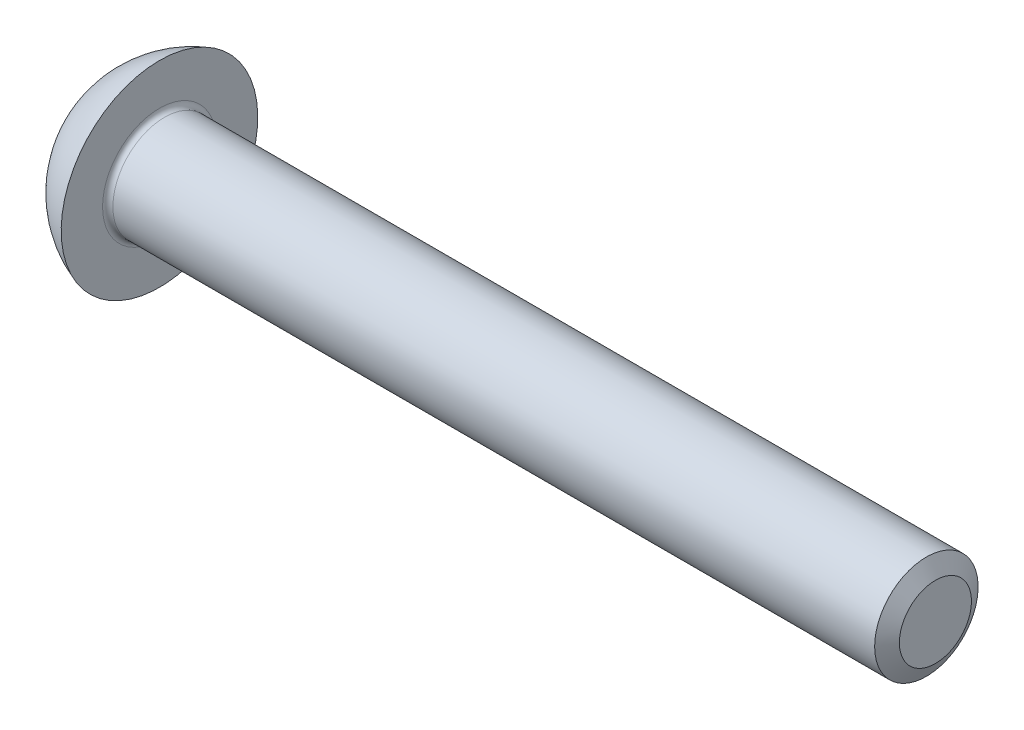
from build123d import *

# Parameters (mm, degrees)
CUT_EXTRUDE_1_DEPTH = 2.2


with BuildPart() as part:
    # 草图1 → 旋转1 (revolve)
    with BuildSketch(Plane.XY):
        with BuildLine():
            Line((0, 2), (-29.8, 2))
            ThreePointArc((-29.8, 2), (-29.941421356, 2.058578644), (-30, 2.2))
            Line((-30, 2.2), (-30, 3.8))
            ThreePointArc((-30, 3.8), (-31.264955669, 3.101612484), (-32.2, 2))
            Line((-32.2, 2), (-32.2, 0))
            Line((-32.2, 0), (0, 0))
            Line((0, 0), (0, 2))
        make_face()
    revolve(axis=Axis((-32.2, 0, 0), (1, 0, 0)))

    # 草图2 → 切除-拉伸1 (cut)
    with BuildSketch(Plane.ZY.offset(32.2)):
        Polygon((0, 1.443375673), (-1.25, 0.721687836), (-1.25, -0.721687836), (0, -1.443375673), (1.25, -0.721687836), (1.25, 0.721687836), align=None)
    extrude(amount=-CUT_EXTRUDE_1_DEPTH, mode=Mode.SUBTRACT)

    # 草图6 → 旋转2 (revolve)
    with BuildSketch(Plane.XY):
        Polygon((-30.9, 1.443375673), (-30, 0), (-29.63, 0), (-29.63, 1.443375673), align=None)
    revolve(axis=Axis((-32.2, 0, 0), (1, 0, 0)))

    # 草图7 → 切除-旋转5 (revolve, cut)
    with BuildSketch(Plane.XY):
        Polygon((-32.2, 1.443375673), (-31.83, 0), (-32.2, 0), align=None)
    revolve(axis=Axis((-32.2, 0, 0), (1, 0, 0)), mode=Mode.SUBTRACT)

    # 草图4 → 切除-旋转1 (revolve, cut)
    with BuildSketch(Plane.XY):
        Polygon((-0.35, 2), (0, 1.393782217), (0.35, 2), align=None)
    revolve(axis=Axis((-0.35, 0, 0), (1, 0, 0)), mode=Mode.SUBTRACT)


solid = part.part
